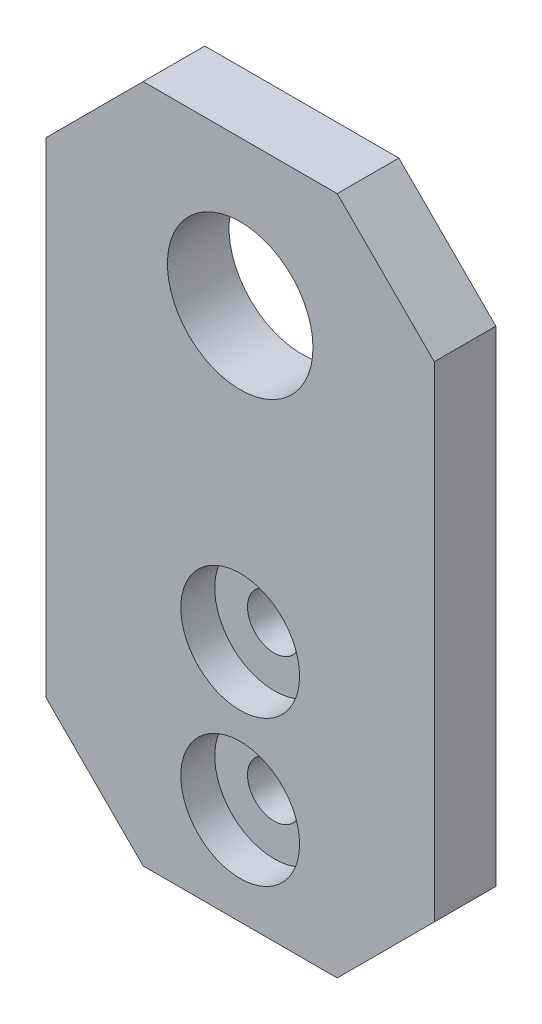
from build123d import *

# Parameters (mm, degrees)
SKETCH1_W                               = 40
SKETCH1_H                               = 70
SKETCH1_R                               = 7.5
BOSS_EXTRUDE1_DEPTH                     = 6.35
CBORE_FOR_M5_HEX_HEAD_BOLT1_D           = 5.5
CBORE_FOR_M5_HEX_HEAD_BOLT1_CBORE_D     = 12.238
CBORE_FOR_M5_HEX_HEAD_BOLT1_CBORE_DEPTH = 3.5
CHAMFER1_SIZE                           = 10


with BuildPart() as part:
    # Sketch1 → Boss-Extrude1 (new body)
    with BuildSketch(Plane.XY):
        Rectangle(SKETCH1_W, SKETCH1_H)
        with Locations((0, 20)):
            Circle(SKETCH1_R, mode=Mode.SUBTRACT)
    extrude(amount=BOSS_EXTRUDE1_DEPTH)

    # CBORE for M5 Hex Head Bolt1 (through all)
    with Locations(Plane.XY.offset(6.35)):
        with Locations((0, -10), (0, -25)):
            CounterBoreHole(CBORE_FOR_M5_HEX_HEAD_BOLT1_D / 2, CBORE_FOR_M5_HEX_HEAD_BOLT1_CBORE_D / 2, CBORE_FOR_M5_HEX_HEAD_BOLT1_CBORE_DEPTH)

    # Chamfer1
    chamfer1_edges = [part.edges().sort_by_distance(p)[0] for p in [
        (20, -35, 3.175),
        (-20, -35, 3.175),
        (20, 35, 3.175),
        (-20, 35, 3.175),
    ]]
    chamfer(chamfer1_edges, length=CHAMFER1_SIZE)


solid = part.part
